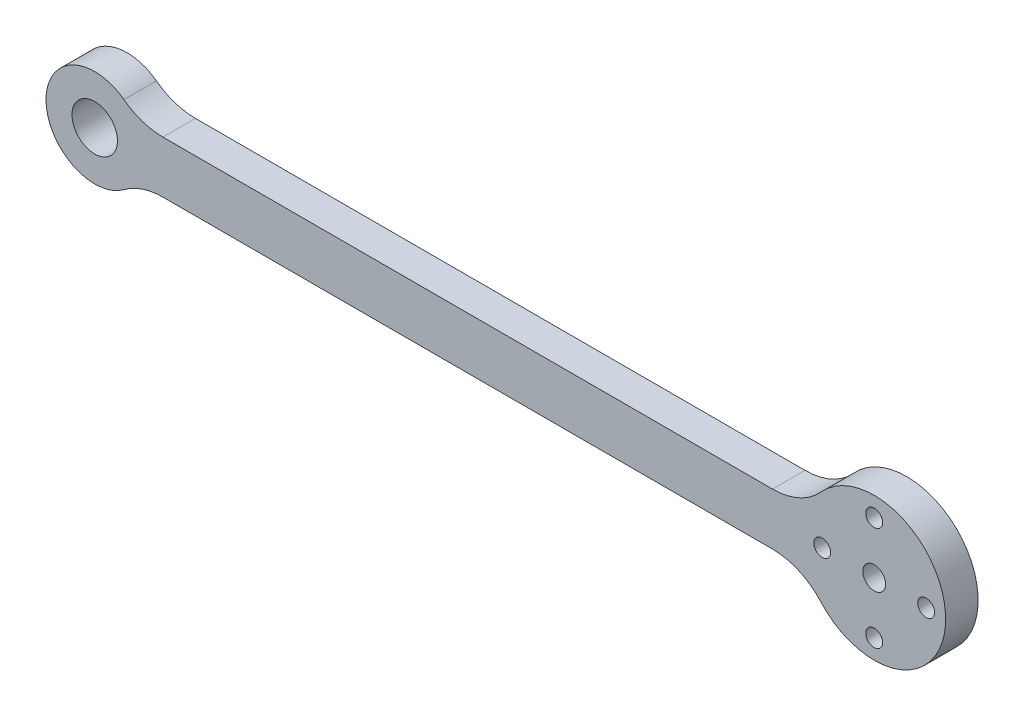
from build123d import *

# Parameters (mm, degrees)
SKETCH1_R          = 3.5
SKETCH1_R_2        = 1.3
SKETCH1_R_3        = 1.75
BASE_FLANGE1_DEPTH = 5
FILLET1_R          = 10
FILLET2_R          = 10


# Sheet-metal steps are written as plain solids
with BuildPart() as part:
    # Sketch1 → Base-Flange1 (new body)
    with BuildSketch(Plane.XY):
        with BuildLine():
            Line((6.34428877, 4), (109.753049234, 4))
            ThreePointArc((109.753049234, 4), (131, 0), (109.753049234, -4))
            Line((109.753049234, -4), (6.34428877, -4))
            ThreePointArc((6.34428877, -4), (-7.5, 0), (6.34428877, 4))
        make_face()
        Circle(SKETCH1_R, mode=Mode.SUBTRACT)
        with Locations((112, 0)):
            Circle(SKETCH1_R_2, mode=Mode.SUBTRACT)
        with Locations((120, -8)):
            Circle(SKETCH1_R_2, mode=Mode.SUBTRACT)
        with Locations((128, 0)):
            Circle(SKETCH1_R_2, mode=Mode.SUBTRACT)
        with Locations((120, 8)):
            Circle(SKETCH1_R_2, mode=Mode.SUBTRACT)
        with Locations((120, 0)):
            Circle(SKETCH1_R_3, mode=Mode.SUBTRACT)
    extrude(amount=-BASE_FLANGE1_DEPTH)

    # Fillet1
    fillet1_edges = [part.edges().sort_by_distance(p)[0] for p in [
        (6.34428877, 4, -2.5),
        (6.34428877, -4, -2.5),
    ]]
    fillet(fillet1_edges, radius=FILLET1_R)

    # Fillet2
    fillet2_edges = [part.edges().sort_by_distance(p)[0] for p in [
        (109.753049234, 4, -2.5),
        (109.753049234, -4, -2.5),
    ]]
    fillet(fillet2_edges, radius=FILLET2_R)


solid = part.part
